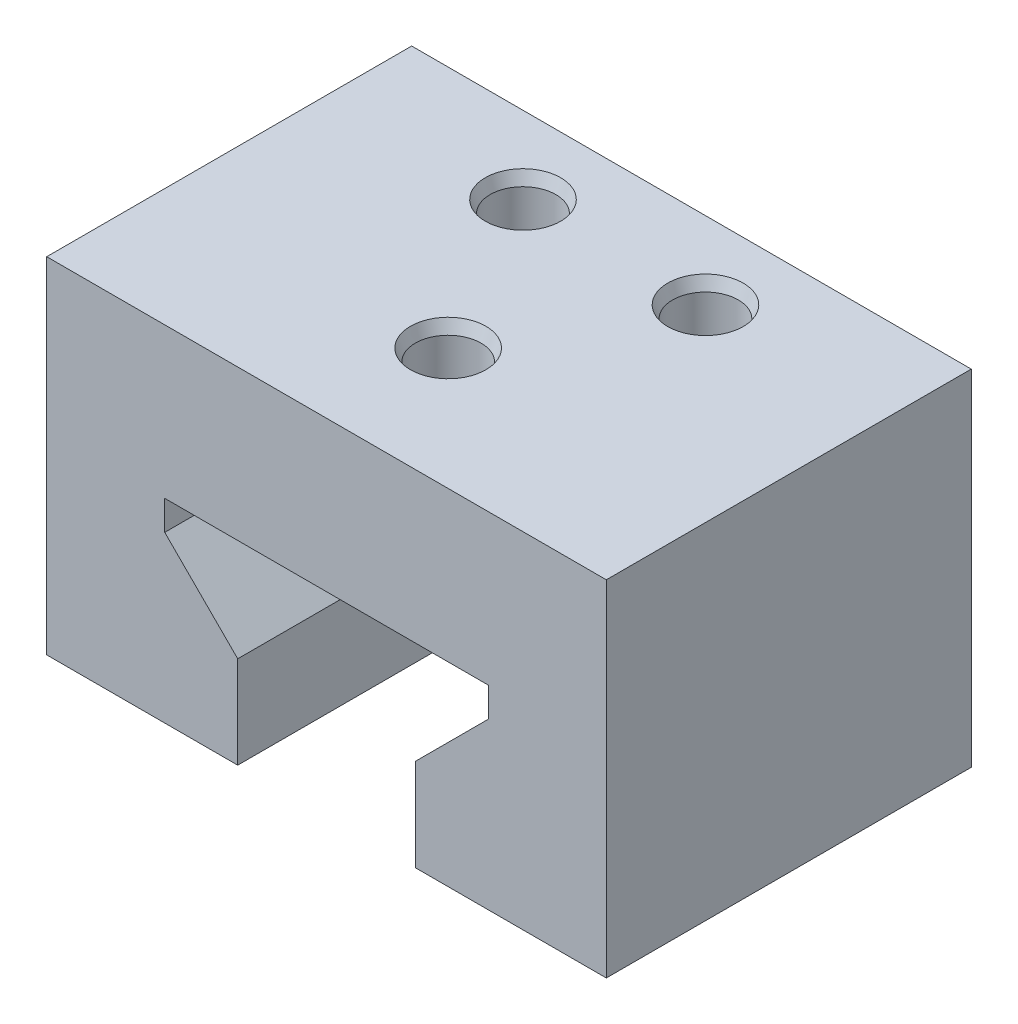
from build123d import *
from OCP.BRepFilletAPI import BRepFilletAPI_MakeChamfer

# Parameters (mm, degrees)
BOSS_EXTRUDE1_DEPTH = 30
HOLE1_D             = 5.4
HOLE1_DEPTH         = 12.35
HOLE1_CBORE_D       = 6.2
HOLE1_CBORE_DEPTH   = 1
CHAMFER1_SIZE       = 1
CHAMFER1_SIZE_2     = 0.4


with BuildPart() as part:
    # Sketch1 → Boss-Extrude1 (new body)
    with BuildSketch(Plane.XY):
        Polygon((-7.3, 0.3), (-7.3, 7.875735931), (-13.3, 13.875735931), (-13.3, 16.3), (13.3, 16.3), (13.3, 13.875735931), (7.3, 7.875735931), (7.3, 0.3), (23, 0.3), (23, 28.65), (-23, 28.65), (-23, 0.3), align=None)
    extrude(amount=BOSS_EXTRUDE1_DEPTH)

    # Hole1
    with Locations(Plane(origin=(0, 28.65, 0), x_dir=(1, 0, 0), z_dir=(0, 1, 0))):
        with Locations((-7.5, -6.35), (7.5, -6.35), (0, -20)):
            CounterBoreHole(HOLE1_D / 2, HOLE1_CBORE_D / 2, HOLE1_CBORE_DEPTH, depth=HOLE1_DEPTH)

    # Chamfer1
    chamfer1_edges_1 = [part.edges().sort_by_distance(p)[0] for p in [
        (-3.1, 27.65, 20),
    ]]
    chamfer1_side_1 = [part.faces().sort_by_distance(p)[0] for p in [
        (-3.1, 27.658, 20),
    ]]
    chamfer1_edges_2 = [part.edges().sort_by_distance(p)[0] for p in [
        (4.4, 27.65, 6.35),
    ]]
    chamfer1_side_2 = [part.faces().sort_by_distance(p)[0] for p in [
        (4.4, 27.658, 6.35),
    ]]
    chamfer1_edges_3 = [part.edges().sort_by_distance(p)[0] for p in [
        (-10.6, 27.65, 6.35),
    ]]
    chamfer1_side_3 = [part.faces().sort_by_distance(p)[0] for p in [
        (-10.6, 27.658, 6.35),
    ]]
    chamfer1 = BRepFilletAPI_MakeChamfer(part.part.solid().wrapped)
    for e in chamfer1_edges_1:
        chamfer1.Add(CHAMFER1_SIZE - 0.0001, CHAMFER1_SIZE_2 - 0.0001, e.wrapped, chamfer1_side_1[0].wrapped)
    for e in chamfer1_edges_2:
        chamfer1.Add(CHAMFER1_SIZE - 0.0001, CHAMFER1_SIZE_2 - 0.0001, e.wrapped, chamfer1_side_2[0].wrapped)
    for e in chamfer1_edges_3:
        chamfer1.Add(CHAMFER1_SIZE - 0.0001, CHAMFER1_SIZE_2 - 0.0001, e.wrapped, chamfer1_side_3[0].wrapped)
    add(Compound.cast(chamfer1.Shape()), mode=Mode.REPLACE)  # a hair under: the kernel refuses the full size


solid = part.part
